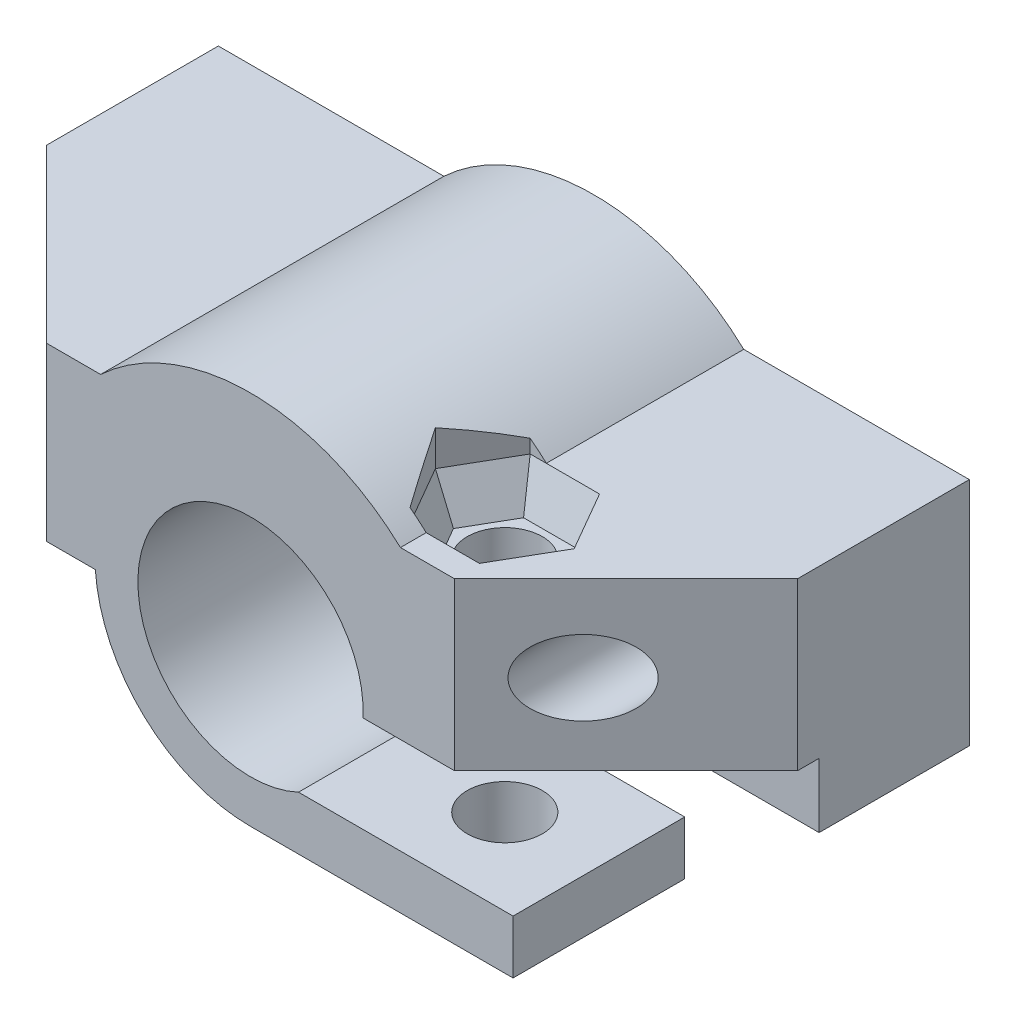
from build123d import *

# Parameters (mm, degrees)
ESBO_O1_R                       = 1.75
RESSALTO_EXTRUS_O1_DEPTH        = 16
ESBO_O3_R                       = 1.75
CORTE_EXTRUS_O2_DEPTH           = 30.470324057
CORTE_EXTRUS_O3_DEPTH           = 2
CORTE_EXTRUS_O3_TAPER           = 20
CORTE_EXTRUS_O3_OTHER_WAY_DEPTH = 6
CORTE_EXTRUS_O4_REACH           = 31.47
ESBO_O5_W                       = 29.879545061
ESBO_O5_H                       = 8
ESBO_O6_W                       = 11
ESBO_O6_H                       = 7
RESSALTO_EXTRUS_O2_DEPTH        = 3
ESBO_O7_W                       = 5.6
ESBO_O7_H                       = 2.5
CORTE_EXTRUS_O6_DEPTH           = 8
ESBO_O8_R                       = 1.65
CORTE_EXTRUS_O7_DEPTH           = 6
CHANFRO1_SIZE                   = 8


with BuildPart() as part:
    # Esboço1 → Ressalto-extrusão1 (new body)
    with BuildSketch(Plane.XY):
        with BuildLine():
            Line((17.5, 7.5), (6.986594306, 7.5))
            ThreePointArc((6.986594306, 7.5), (0, 10.25), (-6.986594306, 7.5))
            Line((-6.986594306, 7.5), (-17.5, 7.5))
            Line((-17.5, 7.5), (-17.5, -0.5))
            Line((-17.5, -0.5), (-7.232738071, -0.5))
            ThreePointArc((-7.232738071, -0.5), (-4.946589734, -5.300353762), (0, -7.25))
            Line((0, -7.25), (12.236067977, -7.25))
            Line((12.236067977, -7.25), (12.236067977, -4.75))
            Line((12.236067977, -4.75), (2.236067977, -4.75))
            ThreePointArc((2.236067977, -4.75), (-4.364690104, 2.917529829), (5.244044241, -0.25))
            Line((5.244044241, -0.25), (12.736067977, -0.25))
            Line((12.736067977, -0.25), (15.807189139, -0.25))
            Line((15.807189139, -0.25), (17.5, -0.25))
            Line((17.5, -0.25), (17.5, 7.5))
        make_face()
        with Locations((12.5, 3.5)):
            Circle(ESBO_O1_R, mode=Mode.SUBTRACT)
        with Locations(Location((-12.5, 3.5, 0), (0, 0, 180))):
            Circle(ESBO_O1_R, mode=Mode.SUBTRACT)
    extrude(amount=RESSALTO_EXTRUS_O1_DEPTH)

    # Esboço3 → Corte-extrusão2 (cut, through all)
    with BuildSketch(Plane.XZ.offset(7.25)):
        with Locations(Location((7.85, 12, 0), (0, 0, 240.437367967))):
            Circle(ESBO_O3_R)
    extrude(amount=-CORTE_EXTRUS_O2_DEPTH, mode=Mode.SUBTRACT)

    # Esboço4 → Corte-extrusão3 (cut)
    with BuildSketch(Plane(origin=(0, 7.5, 0), x_dir=(1, 0, 0), z_dir=(0, 1, 0))):
        Polygon((11.083161507, -12), (9.466580754, -9.2), (6.233419246, -9.2), (4.616838493, -12), (6.233419246, -14.8), (9.466580754, -14.8), align=None)
    extrude(amount=-CORTE_EXTRUS_O3_DEPTH, taper=CORTE_EXTRUS_O3_TAPER, mode=Mode.SUBTRACT)

    # Esboço4 → Corte-extrusão3 other way (cut)
    with BuildSketch(Plane(origin=(0, 7.5, 0), x_dir=(1, 0, 0), z_dir=(0, 1, 0))):
        Polygon((11.083161507, -12), (9.466580754, -9.2), (6.233419246, -9.2), (4.616838493, -12), (6.233419246, -14.8), (9.466580754, -14.8), align=None)
    extrude(amount=CORTE_EXTRUS_O3_OTHER_WAY_DEPTH, mode=Mode.SUBTRACT)

    # Corte-extrusão4: up to this face of the body (flat: up to its plane)
    corte_extrus_o4_end = Plane(part.part.faces().sort_by_distance((-12.366369035, -0.5, 8))[0])
    # Esboço5 → Corte-extrusão4 (cut, up to the picked face)
    with BuildSketch(Plane.XZ.offset(7.25), mode=Mode.PRIVATE) as corte_extrus_o4_sk1:
        with Locations((-2.703704553, 4)):
            Rectangle(ESBO_O5_W, ESBO_O5_H)
    corte_extrus_o4_tool1 = split(extrude(corte_extrus_o4_sk1.sketch, amount=-CORTE_EXTRUS_O4_REACH, mode=Mode.PRIVATE), bisect_by=corte_extrus_o4_end, keep=Keep.BOTH, mode=Mode.PRIVATE)
    add(corte_extrus_o4_tool1.solids().sort_by(Axis((-2.703705, -7.25, 4), (0, 1, 0)))[0], mode=Mode.SUBTRACT)

    # Esboço6 → Ressalto-extrusão2 (add)
    with BuildSketch(Plane.XZ.offset(0.25)):
        with Locations((12, 3.5)):
            Rectangle(ESBO_O6_W, ESBO_O6_H)
        with Locations((-12, 3.5)):
            Rectangle(ESBO_O6_W, ESBO_O6_H)
    extrude(amount=RESSALTO_EXTRUS_O2_DEPTH)

    # Esboço7 → Corte-extrusão6 (cut)
    with BuildSketch(Plane(origin=(0, 0, 0), x_dir=(-1, 0, 0), z_dir=(0, 0, -1))):
        with Locations((-12.5, 0.8)):
            Rectangle(ESBO_O7_W, ESBO_O7_H)
        with Locations((12.5, 0.8)):
            Rectangle(ESBO_O7_W, ESBO_O7_H)
    extrude(amount=-CORTE_EXTRUS_O6_DEPTH, mode=Mode.SUBTRACT)

    # Esboço8 → Corte-extrusão7 (cut)
    with BuildSketch(Plane.XZ.offset(3.25)):
        with Locations(Location((12.5, 4, 0), (0, 0, 270))):
            Circle(ESBO_O8_R)
        with Locations(Location((-12.5, 4, 0), (0, 0, 270))):
            Circle(ESBO_O8_R)
    extrude(amount=-CORTE_EXTRUS_O7_DEPTH, mode=Mode.SUBTRACT)

    # Chanfro1
    # the kernel refuses this chamfer: 8 mm, written as the material it takes off along each edge
    with BuildSketch(Plane(origin=(17.5, -20.823463904, 16), x_dir=(0.027495876610586487, 0, -0.9996219169112968), z_dir=(0, 1, 0))) as chanfro1_piece_1_section:
        Polygon((CHANFRO1_SIZE * 0.999621916911, CHANFRO1_SIZE * 0.0274958766106), (-CHANFRO1_SIZE * 0.0274958766106, CHANFRO1_SIZE * 0.999621916911), (0, 0), align=None)
    chanfro1_piece_1 = extrude(amount=48.896927807, mode=Mode.PRIVATE)
    chanfro1_piece_1 = split(chanfro1_piece_1, bisect_by=Plane(origin=(15.518542318, -4.75, 12.990728841), z_dir=(0, 1, 0)), keep=Keep.TOP, mode=Mode.PRIVATE)
    add(chanfro1_piece_1, mode=Mode.SUBTRACT)
    with BuildSketch(Plane(origin=(-17.5, 28.073463904, 16), x_dir=(0.9996219169112968, 0, 0.027495876610586494), z_dir=(0, -1, 0))) as chanfro1_piece_2:
        Polygon((CHANFRO1_SIZE * 0.999621916911, -CHANFRO1_SIZE * 0.0274958766106), (-CHANFRO1_SIZE * 0.0274958766106, -CHANFRO1_SIZE * 0.999621916911), (0, 0), align=None)
    extrude(amount=49.146927807, mode=Mode.SUBTRACT)


solid = part.part
